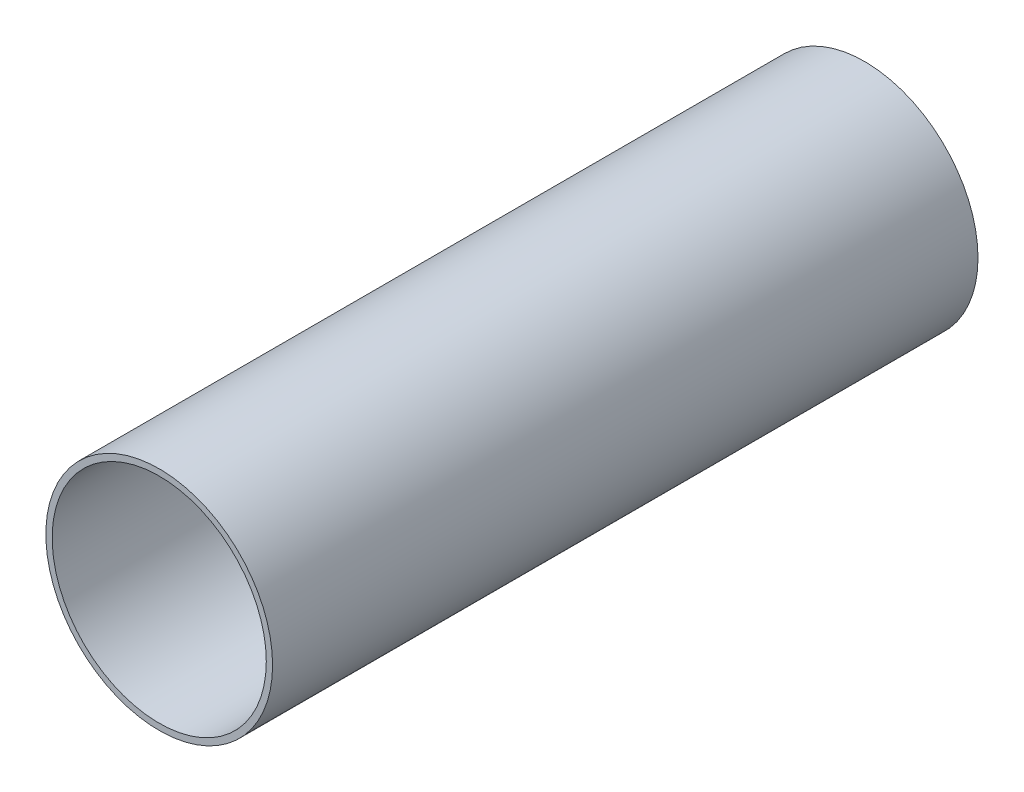
from build123d import *

# Parameters (mm, degrees)
SKETCH1_R           = 28.575
SKETCH1_R_2         = 26.9875
BOSS_EXTRUDE1_DEPTH = 177.8


with BuildPart() as part:
    # Sketch1 → Boss-Extrude1 (new body)
    with BuildSketch(Plane.XY):
        Circle(SKETCH1_R)
        Circle(SKETCH1_R_2, mode=Mode.SUBTRACT)
    extrude(amount=BOSS_EXTRUDE1_DEPTH)


solid = part.part
